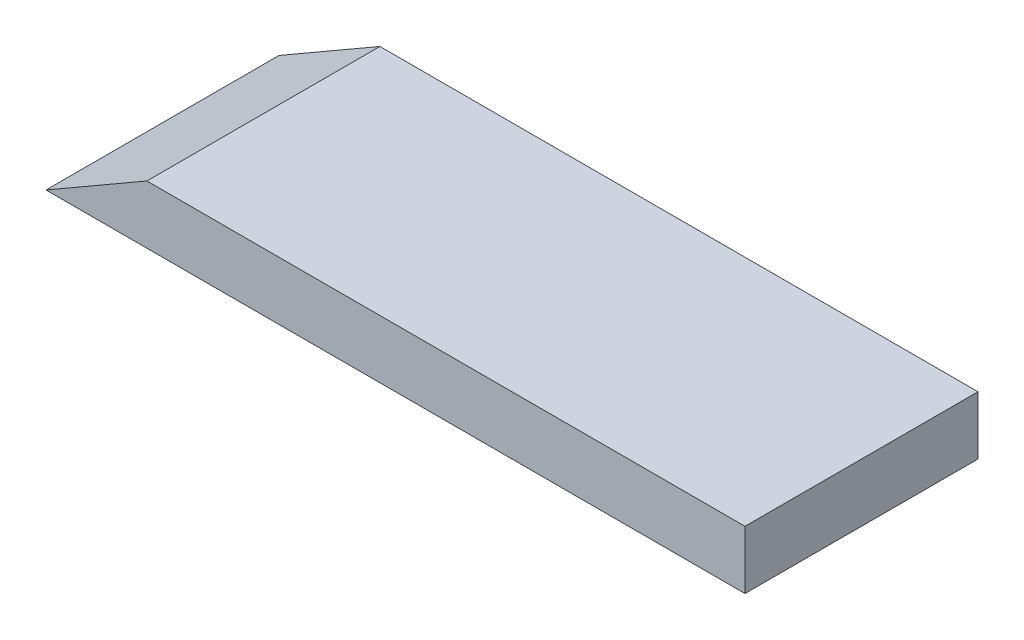
from build123d import *

# Parameters (mm, degrees)
SKETCH1_W           = 76.2
SKETCH1_H           = 25.4
BOSS_EXTRUDE1_DEPTH = 3.175
CHAMFER8_SIZE2      = 10.998522628
CHAMFER8_SIZE       = 6.35


with BuildPart() as part:
    # Sketch1 → Boss-Extrude1 (new, symmetric)
    with BuildSketch(Plane(origin=(0, 0, 0), x_dir=(1, 0, 0), z_dir=(0, 1, 0))):
        Rectangle(SKETCH1_W, SKETCH1_H)
    extrude(amount=BOSS_EXTRUDE1_DEPTH, both=True)

    # Chamfer8
    chamfer8_edges = [part.edges().sort_by_distance(p)[0] for p in [
        (-38.1, 3.175, 0),
    ]]
    chamfer8_side = [part.faces().sort_by_distance(p)[0] for p in [
        (-38.1, 3.048, 0),
    ]]
    chamfer(chamfer8_edges, length=CHAMFER8_SIZE - 0.0001, length2=CHAMFER8_SIZE2 - 0.0001, reference=chamfer8_side[0])  # a hair under: the kernel refuses the full size


solid = part.part
